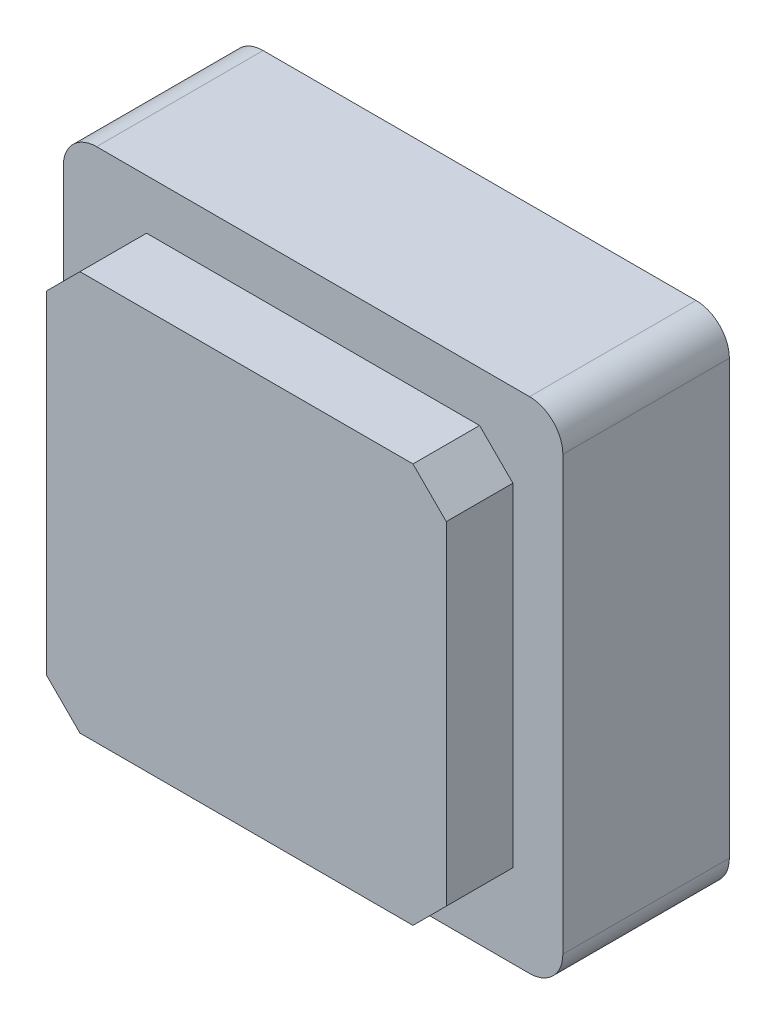
from build123d import *

# Parameters (mm, degrees)
ESQUISSE1_W        = 15
ESQUISSE1_H        = 15
BOSS_EXTRU_1_DEPTH = 5
CONG_1_R           = 1
ESQUISSE2_R        = 1.5
BOSS_EXTRU_2_DEPTH = 0.3
CONG_2_R           = 1
ESQUISSE4_W        = 12
ESQUISSE4_H        = 12
BOSS_EXTRU_4_DEPTH = 2
CHANFREIN1_SIZE    = 1


with BuildPart() as part:
    # Esquisse1 → Boss.-Extru.1 (new body)
    with BuildSketch(Plane.XY):
        Rectangle(ESQUISSE1_W, ESQUISSE1_H)
    extrude(amount=BOSS_EXTRU_1_DEPTH)

    # Congé1
    cong_1_edges = [part.edges().sort_by_distance(p)[0] for p in [
        (7.5, -7.5, 2.5),
        (-7.5, -7.5, 2.5),
        (-7.5, 7.5, 2.5),
        (7.5, 7.5, 2.5),
    ]]
    fillet(cong_1_edges, radius=CONG_1_R)

    # Esquisse2 → Boss.-Extru.2 (add)
    with BuildSketch(Plane(origin=(0, 0, 0), x_dir=(-1, 0, 0), z_dir=(0, 0, -1))):
        with Locations((3.260921735, 0)):
            Circle(ESQUISSE2_R)
    extrude(amount=BOSS_EXTRU_2_DEPTH)

    # Congé2
    # the kernel refuses this fillet: 1 mm, written as the material it takes off along each edge
    with BuildSketch(Plane(origin=(-3.260921735, 0, -0.3), x_dir=(-1, 0, 0), z_dir=(0, -1, 0))) as cong_2_piece_1:
        with BuildLine():
            CenterArc((0.785857157, -1), CONG_2_R, 44.427004001, 45.572995999)
            Line((0.785857157, 0), (0.785857157, 0.02))
            Line((0.785857157, 0.02), (1.5, 0.02))
            Line((1.5, 0.02), (1.52, 0))
            ThreePointArc((1.52, 0), (1.52, -0.15), (1.514282857, -0.286))
            Line((1.514282857, -0.286), (1.5, -0.3))
        make_face()
    revolve(axis=Axis((-3.260921735, 0, -0.3), (0, 0, -1)), mode=Mode.SUBTRACT)

    # Esquisse4 → Boss.-Extru.4 (add)
    with BuildSketch(Plane.XY.offset(5)):
        Rectangle(ESQUISSE4_W, ESQUISSE4_H)
    extrude(amount=BOSS_EXTRU_4_DEPTH)

    # Chanfrein1
    chanfrein1_edges = [part.edges().sort_by_distance(p)[0] for p in [
        (6, -6, 6),
        (6, 6, 6),
        (-6, 6, 6),
        (-6, -6, 6),
    ]]
    chamfer(chanfrein1_edges, length=CHANFREIN1_SIZE)


solid = part.part
